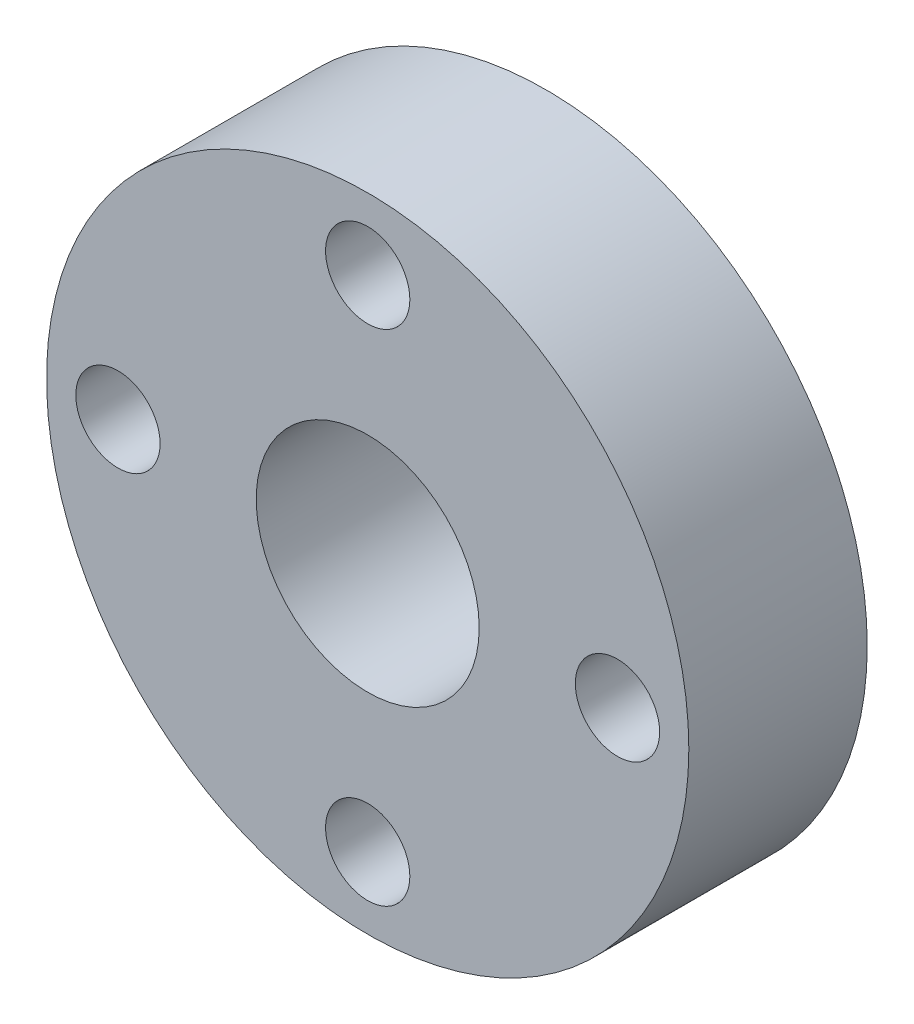
from build123d import *

# Parameters (mm, degrees)
SKETCH1_R             = 11.43
SKETCH1_R_2           = 3.96875
BOSS_EXTRUDE1_DEPTH   = 6.35
F_3_0MM_DOWEL_HOLE1_D = 3
CIRPATTERN1_COUNT     = 4


with BuildPart() as part:
    # Sketch1 → Boss-Extrude1 (new body)
    with BuildSketch(Plane.XY):
        Circle(SKETCH1_R)
        Circle(SKETCH1_R_2, mode=Mode.SUBTRACT)
    extrude(amount=BOSS_EXTRUDE1_DEPTH)

    # Ø3.0mm Dowel Hole1 (through all)
    with Locations(Plane.XY.offset(6.35)):
        with Locations((0, 8.89)):
            f_3_0mm_dowel_hole1 = Hole(F_3_0MM_DOWEL_HOLE1_D / 2)

    # CirPattern1: Ø3.0mm Dowel Hole1 ×4 about axis
    cirpattern1_axis = Axis((0, 0, 6.35), (0, 0, -1))
    for i in range(1, CIRPATTERN1_COUNT):
        add(f_3_0mm_dowel_hole1.rotate(cirpattern1_axis, i * 360 / CIRPATTERN1_COUNT), mode=Mode.SUBTRACT)


solid = part.part
